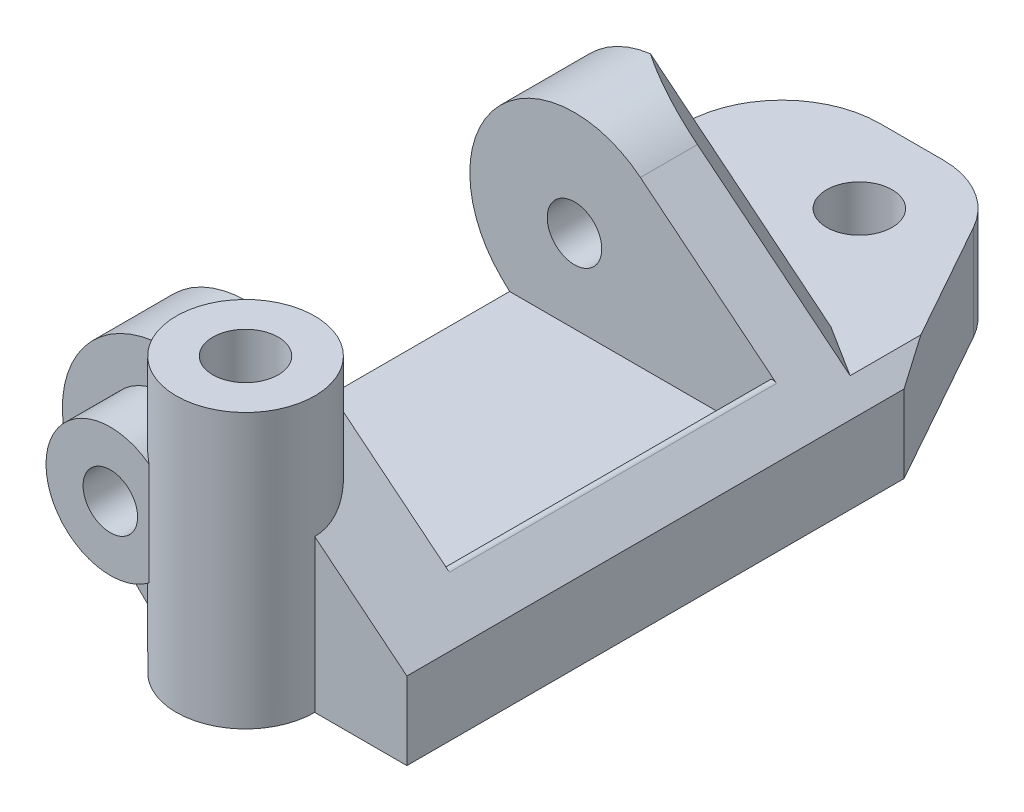
from build123d import *

# Parameters (mm, degrees)
BOSS_EXTRUDE1_DEPTH = 4.35
BOSS_EXTRUDE2_DEPTH = 22.8
CUT_EXTRUDE1_DEPTH  = 35.228241264
BOSS_EXTRUDE3_START = -12.57
SKETCH5_R           = 3.175
BOSS_EXTRUDE3_DEPTH = 12.57
SKETCH6_R           = 2.95
BOSS_EXTRUDE4_DEPTH = 2.6
CHAMFER1_SIZE       = 1.5
SKETCH7_R           = 1.5
CUT_EXTRUDE2_DEPTH  = 26.053852665
SKETCH8_R           = 1.25
CUT_EXTRUDE3_DEPTH  = 37.969425255
SKETCH9_W           = 15
SKETCH9_H           = 8.6
CUT_EXTRUDE4_DEPTH  = 25.4
CHAMFER2_SIZE       = 2.5
FILLET1_R           = 0.25


with BuildPart() as part:
    # Sketch2 → Boss-Extrude1 (new body)
    with BuildSketch(Plane(origin=(0, 0, 0), x_dir=(1, 0, 0), z_dir=(0, 1, 0))):
        with BuildLine():
            ThreePointArc((1.475, -16), (-1.7, -12.825), (-4.875, -16))
            Line((-4.875, -16), (1.475, -16))
        make_face()
        with BuildLine():
            Line((1.475, -16), (-4.875, -16))
            ThreePointArc((-4.875, -16), (-1.7, -19.175), (1.475, -16))
        make_face()
        with BuildLine():
            Line((-5.7, 15.863484846), (-5.7, 6.8))
            Line((-5.7, 6.8), (-5.7, -16))
            Line((-5.7, -16), (-4.875, -16))
            ThreePointArc((-4.875, -16), (-1.7, -12.825), (1.475, -16))
            Line((1.475, -16), (5.7, -16))
            Line((5.7, -16), (5.7, 6.8))
            Line((5.7, 6.8), (1.660846582, 14.02808686))
            ThreePointArc((1.660846582, 14.02808686), (0.248315373, 15.470627532), (-1.7, 16))
            Line((-1.7, 16), (-4.6, 16))
            ThreePointArc((-4.6, 16), (-5.154219358, 15.965740801), (-5.7, 15.863484846))
        make_face()
        with BuildLine():
            Line((-9.1, 6.8), (-5.7, 6.8))
            Line((-5.7, 6.8), (-5.7, 15.863484846))
            ThreePointArc((-5.7, 15.863484846), (-8.14964787, 14.265863337), (-9.1, 11.5))
            Line((-9.1, 11.5), (-9.1, 6.8))
        make_face()
    extrude(amount=BOSS_EXTRUDE1_DEPTH)

    # Sketch3 → Boss-Extrude2 (add)
    with BuildSketch(Plane.XY.offset(16)):
        with BuildLine():
            Line((5.7, 0.79), (-4.875, 4.092368421))
            Line((-4.875, 4.092368421), (-4.875, 2.831147875))
            ThreePointArc((-4.875, 2.831147875), (-1.758813758, 1.290370349), (-0.5, -1.95))
            ThreePointArc((-0.5, -1.95), (-0.966901247, -4.015007311), (-2.276772998, -5.678283585))
            Line((-2.276772998, -5.678283585), (5.7, 0.79))
        make_face()
        with BuildLine():
            ThreePointArc((-5.7, 2.833304297), (-7.287324911, 2.419272216), (-8.642534504, 1.494918444))
            ThreePointArc((-8.642534504, 1.494918444), (-8.890152665, -5.136032618), (-2.276772998, -5.678283585))
            ThreePointArc((-2.276772998, -5.678283585), (-0.966901247, -4.015007311), (-0.5, -1.95))
            ThreePointArc((-0.5, -1.95), (-1.758813758, 1.290370349), (-4.875, 2.831147875))
            Line((-4.875, 2.831147875), (-4.875, 0))
            Line((-4.875, 0), (-5.7, 0))
            Line((-5.7, 0), (-5.7, 2.833304297))
        make_face()
        with BuildLine():
            ThreePointArc((-4.875, 2.831147875), (-5.287453585, 2.849983603), (-5.7, 2.833304297))
            Line((-5.7, 2.833304297), (-5.7, 0))
            Line((-5.7, 0), (-4.875, 0))
            Line((-4.875, 0), (-4.875, 2.831147875))
        make_face()
        with BuildLine():
            Line((-4.875, 4.092368421), (-5.7, 4.35))
            Line((-5.7, 4.35), (-5.7, 2.833304297))
            ThreePointArc((-5.7, 2.833304297), (-5.287453585, 2.849983603), (-4.875, 2.831147875))
            Line((-4.875, 2.831147875), (-4.875, 4.092368421))
        make_face()
        with BuildLine():
            Line((-5.7, 2.833304297), (-5.7, 4.35))
            Line((-5.7, 4.35), (-8.642534504, 1.494918444))
            ThreePointArc((-8.642534504, 1.494918444), (-7.287324911, 2.419272216), (-5.7, 2.833304297))
        make_face()
    extrude(amount=-BOSS_EXTRUDE2_DEPTH)

    # Sketch4 → Cut-Extrude1 (cut, through all)
    with BuildSketch(Plane.XY.offset(16)):
        Polygon((5.7, 0), (5.7, 0.79), (4.725761535, 0), align=None)
    extrude(amount=-CUT_EXTRUDE1_DEPTH, mode=Mode.SUBTRACT)

    # Sketch5 → Boss-Extrude3 (add)
    with BuildSketch(Plane(origin=(0, 4.35, 0), x_dir=(1, 0, 0), z_dir=(0, 1, 0)).offset(BOSS_EXTRUDE3_START)):
        with Locations(Location((-1.7, -16, 0), (0, 0, 100.46651796))):
            Circle(SKETCH5_R)
    extrude(amount=BOSS_EXTRUDE3_DEPTH)

    # Sketch6 → Boss-Extrude4 (add)
    with BuildSketch(Plane.XY.offset(16)):
        with Locations((-5.3, -1.95)):
            Circle(SKETCH6_R)
    extrude(amount=BOSS_EXTRUDE4_DEPTH)

    # Chamfer1
    # the kernel refuses this chamfer: 1.5 mm, written as the material it takes off along each edge
    with BuildSketch(Plane(origin=(-5.273011582, -8.107902789, -6.8), x_dir=(0.017317974295388713, -0.021356755298707605, 0.9996219169112968), z_dir=(0.7767257469610731, 0.6298389587884852, 0))) as chamfer1_piece_1_section:
        Polygon((CHAMFER1_SIZE * 0.999621916911, -CHAMFER1_SIZE * 0.0274958766106), (-CHAMFER1_SIZE * 0.0274958766106, -CHAMFER1_SIZE * 0.999621916911), (0, 0), align=None)
    chamfer1_piece_1 = extrude(amount=16.730502051, mode=Mode.PRIVATE)
    chamfer1_piece_1 = split(chamfer1_piece_1, bisect_by=Plane(origin=(-2.677352376, 0, -6.368001428), z_dir=(0, -1, 0)), keep=Keep.TOP, mode=Mode.PRIVATE)
    add(chamfer1_piece_1, mode=Mode.SUBTRACT)

    # Sketch7 → Cut-Extrude2 (cut, through all)
    with BuildSketch(Plane(origin=(0, 4.35, 0), x_dir=(1, 0, 0), z_dir=(0, 1, 0))):
        with Locations(Location((-1.7, 12.15, 0), (0, 0, 270))):
            Circle(SKETCH7_R)
        with Locations(Location((-1.7, -16, 0), (0, 0, 270))):
            Circle(SKETCH7_R)
    extrude(amount=-CUT_EXTRUDE2_DEPTH, mode=Mode.SUBTRACT)

    # Sketch8 → Cut-Extrude3 (cut, through all)
    with BuildSketch(Plane.XY.offset(18.6)):
        with Locations((-5.3, -1.95)):
            Circle(SKETCH8_R)
    extrude(amount=-CUT_EXTRUDE3_DEPTH, mode=Mode.SUBTRACT)

    # Sketch9 → Cut-Extrude4 (cut)
    with BuildSketch(Plane(origin=(3.7, 0, 0), x_dir=(0, 0, -1), z_dir=(1, 0, 0))):
        with Locations((-4.814141793, -2.45)):
            Rectangle(SKETCH9_W, SKETCH9_H)
    extrude(amount=-CUT_EXTRUDE4_DEPTH, mode=Mode.SUBTRACT)

    # Chamfer2
    chamfer2_edges = [part.edges().sort_by_distance(p)[0] for p in [
        (3.7, 1.85, 4.814141793),
    ]]
    chamfer(chamfer2_edges, length=CHAMFER2_SIZE)

    # Fillet1
    # the kernel refuses this fillet: 0.25 mm, written as the material it takes off along each edge
    with BuildSketch(Plane(origin=(3.7, -0.831779531, 12.314141793), x_dir=(0, 1, 0), z_dir=(0, 0, -1))) as fillet1_piece_1:
        with BuildLine():
            CenterArc((0.408056999, 0.106294437), FILLET1_R, 140.961757793, 64.20015701)
            Line((0.213875562, 0.263754177), (0, 0))
            Line((0, 0), (0.181779531, 0))
        make_face()
    extrude(amount=15, mode=Mode.SUBTRACT)


with BuildPart() as body_2:
    # Mirror1: mirrored copy
    add(part.part.mirror(Plane.ZX.offset(4.35)))


solid = body_2.part
